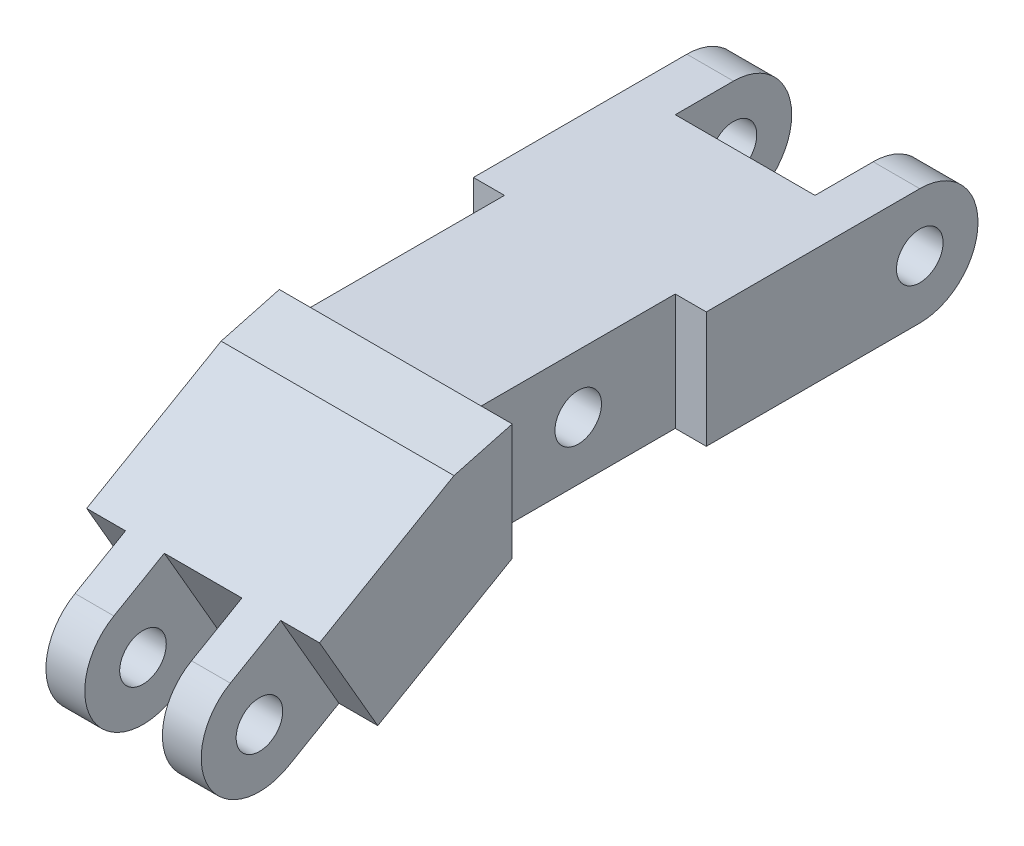
from build123d import *

# Parameters (mm, degrees)
SKETCH1_W            = 30
SKETCH1_H            = 15
BOSS_EXTRUDE1_DEPTH  = 45
SKETCH2_W            = 6
SKETCH2_H            = 15
BOSS_EXTRUDE2_DEPTH  = 7.5
BOSS_EXTRUDE3_DEPTH  = 6
BOSS_EXTRUDE4_START  = -24
BOSS_EXTRUDE4_DEPTH  = 6
SKETCH4_R            = 3
CUT_EXTRUDE1_DEPTH   = 30
SKETCH18_W           = 30
SKETCH18_H           = 15
BOSS_EXTRUDE10_DEPTH = 20
BOSS_EXTRUDE11_DEPTH = 30
SKETCH19_W           = 5
SKETCH19_H           = 15
BOSS_EXTRUDE12_DEPTH = 7.5
CUT_EXTRUDE7_REACH   = 88.894
SKETCH22_W           = 4
SKETCH22_H           = 25
SKETCH23_R           = 3
CUT_EXTRUDE8_DEPTH   = 83.00662079
BOSS_EXTRUDE15_DEPTH = 5
BOSS_EXTRUDE16_START = -15
BOSS_EXTRUDE16_DEPTH = 5
SKETCH25_R           = 3
CUT_EXTRUDE10_DEPTH  = 20


with BuildPart() as part:
    # Sketch1 → Boss-Extrude1 (new body)
    with BuildSketch(Plane.XY):
        with Locations((15, 7.5)):
            Rectangle(SKETCH1_W, SKETCH1_H)
    extrude(amount=BOSS_EXTRUDE1_DEPTH)

    # Sketch2 → Boss-Extrude2 (add)
    with BuildSketch(Plane(origin=(0, 0, 0), x_dir=(-1, 0, 0), z_dir=(0, 0, -1))):
        with Locations((-27, 7.5)):
            Rectangle(SKETCH2_W, SKETCH2_H)
        with Locations((-3, 7.5)):
            Rectangle(SKETCH2_W, SKETCH2_H)
    extrude(amount=BOSS_EXTRUDE2_DEPTH)

    # Sketch3 → Boss-Extrude3 (add)
    with BuildSketch(Plane(origin=(30, 0, 0), x_dir=(0, 0, -1), z_dir=(1, 0, 0))):
        with BuildLine():
            Line((7.5, 15), (7.5, 0))
            ThreePointArc((7.5, 0), (15, 7.5), (7.5, 15))
        make_face()
    extrude(amount=-BOSS_EXTRUDE3_DEPTH)

    # Sketch3<2> → Boss-Extrude4 (add)
    with BuildSketch(Plane(origin=(30, 0, 0), x_dir=(0, 0, -1), z_dir=(1, 0, 0)).offset(BOSS_EXTRUDE4_START)):
        with BuildLine():
            Line((7.5, 15), (7.5, 0))
            ThreePointArc((7.5, 0), (15, 7.5), (7.5, 15))
        make_face()
    extrude(amount=-BOSS_EXTRUDE4_DEPTH)

    # Sketch4 → Cut-Extrude1 (cut)
    with BuildSketch(Plane.ZY):
        with Locations((-7.5, 7.5)):
            Circle(SKETCH4_R)
    extrude(amount=-CUT_EXTRUDE1_DEPTH, mode=Mode.SUBTRACT)



with BuildPart() as body_2:
    # Sketch18 → Boss-Extrude10 (new body)
    with BuildSketch(Plane(origin=(0, -19.485571585, 33.75), x_dir=(1, 0, 0), z_dir=(0, -0.500000000000001, 0.866025403784438))):
        with Locations((15, 30)):
            Rectangle(SKETCH18_W, SKETCH18_H)
    extrude(amount=BOSS_EXTRUDE10_DEPTH)


with BuildPart() as part_1:
    add(part.part)

    add(body_2.part)  # Boss-Extrude11 merges body 2
    # 3DSketch1 → Boss-Extrude11 (add)
    with BuildSketch(Plane(origin=(30, 0, 45), x_dir=(0, 1, 0), z_dir=(1, 0, 0))):
        Polygon((0, 0), (15, 0), (12.990381057, 7.5), align=None)
    extrude(amount=-BOSS_EXTRUDE11_DEPTH)

    # Sketch19 → Boss-Extrude12 (add)
    with BuildSketch(Plane(origin=(0, -29.485571585, 51.070508076), x_dir=(1, 0, 0), z_dir=(0, -0.5000000000000009, 0.8660254037844383))):
        with Locations((7.5, 30)):
            Rectangle(SKETCH19_W, SKETCH19_H)
        with Locations((22.5, 30)):
            Rectangle(SKETCH19_W, SKETCH19_H)
    extrude(amount=BOSS_EXTRUDE12_DEPTH)

    # Sketch22 → Cut-Extrude7 (cut, up to next)
    with BuildSketch(Plane(origin=(0, 15, 0), x_dir=(1, 0, 0), z_dir=(0, 1, 0)), mode=Mode.PRIVATE) as cut_extrude7_sk1:
        with Locations((2, -32.5)):
            Rectangle(SKETCH22_W, SKETCH22_H)
    cut_extrude7_tool1 = extrude(cut_extrude7_sk1.sketch, amount=-CUT_EXTRUDE7_REACH, mode=Mode.PRIVATE) & part_1.part
    # Sketch22 → Cut-Extrude7 (cut, up to next)
    with BuildSketch(Plane(origin=(0, 15, 0), x_dir=(1, 0, 0), z_dir=(0, 1, 0)), mode=Mode.PRIVATE) as cut_extrude7_sk2:
        with Locations((28, -32.5)):
            Rectangle(SKETCH22_W, SKETCH22_H)
    cut_extrude7_tool2 = extrude(cut_extrude7_sk2.sketch, amount=-CUT_EXTRUDE7_REACH, mode=Mode.PRIVATE) & part_1.part
    add(cut_extrude7_tool1.solids().sort_by_distance((2, 15, 32.5))[0], mode=Mode.SUBTRACT)
    add(cut_extrude7_tool2.solids().sort_by_distance((28, 15, 32.5))[0], mode=Mode.SUBTRACT)

    # Sketch23 → Cut-Extrude8 (cut, through all)
    with BuildSketch(Plane.ZY.offset(-4)):
        with Locations((32.5, 7.5)):
            Circle(SKETCH23_R)
    extrude(amount=-CUT_EXTRUDE8_DEPTH, mode=Mode.SUBTRACT)

    # Sketch24 → Boss-Extrude15 (add)
    with BuildSketch(Plane(origin=(25, 0, 0), x_dir=(0, 0, -1), z_dir=(1, 0, 0))):
        with BuildLine():
            Line((-76.315698604, -0.759618943), (-68.815698604, -13.75))
            ThreePointArc((-68.815698604, -13.75), (-79.060889132, -11.004809472), (-76.315698604, -0.759618943))
        make_face()
    extrude(amount=-BOSS_EXTRUDE15_DEPTH)

    # Sketch24<2> → Boss-Extrude16 (add)
    with BuildSketch(Plane(origin=(25, 0, 0), x_dir=(0, 0, -1), z_dir=(1, 0, 0)).offset(BOSS_EXTRUDE16_START)):
        with BuildLine():
            Line((-76.315698604, -0.759618943), (-68.815698604, -13.75))
            ThreePointArc((-68.815698604, -13.75), (-79.060889132, -11.004809472), (-76.315698604, -0.759618943))
        make_face()
    extrude(amount=-BOSS_EXTRUDE16_DEPTH)

    # Sketch25 → Cut-Extrude10 (cut)
    with BuildSketch(Plane(origin=(25, 0, 0), x_dir=(0, 0, -1), z_dir=(1, 0, 0))):
        with Locations((-72.565698604, -7.254809472)):
            Circle(SKETCH25_R)
    extrude(amount=-CUT_EXTRUDE10_DEPTH, mode=Mode.SUBTRACT)


solid = part_1.part
